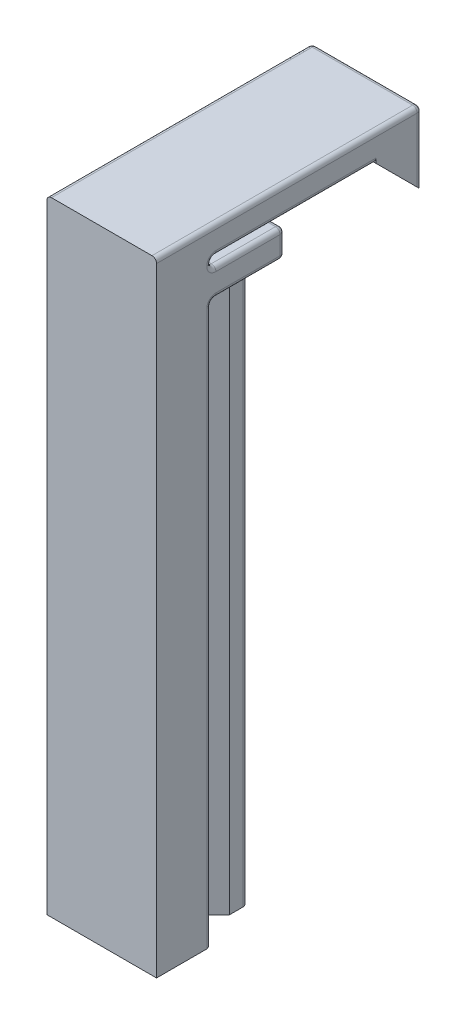
from build123d import *

# Parameters (mm, degrees)
BOSS_EXTRU_1_DEPTH      = 65
ESQUISSE2_W             = 11.96
ESQUISSE2_H             = 28.94
BOSS_EXTRU_2_DEPTH      = 3
ESQUISSE3_W             = 11.96
ESQUISSE3_H             = 8
BOSS_EXTRU_3_DEPTH      = 5
CHANFREIN4_SIZE         = 2
ESQUISSE8_W             = 7.98
ESQUISSE8_H             = 5
ENL_V_MAT_EXTRU_1_DEPTH = 5.96
ESQUISSE9_W             = 3.92
ESQUISSE9_H             = 5
BOSS_EXTRU_5_DEPTH      = 8
BOSS_EXTRU_4_DEPTH      = 8
CONG_2_R                = 0.5
CHANFREIN5_SIZE         = 5


with BuildPart() as part:
    # Esquisse1 → Boss.-Extru.1 (new body)
    with BuildSketch(Plane(origin=(0, 0, 0), x_dir=(1, 0, 0), z_dir=(0, 1, 0))):
        Polygon((7.94, 7.96), (9.97, 7.96), (9.97, 11.94), (1.99, 11.94), (1.99, 7.96), (4.02, 7.96), (4.02, 5.98), (0, 5.98), (0, 0), (11.96, 0), (11.96, 5.98), (7.94, 5.98), align=None)
    extrude(amount=BOSS_EXTRU_1_DEPTH)

    # Esquisse2 → Boss.-Extru.2 (add)
    with BuildSketch(Plane(origin=(0, 65, 0), x_dir=(1, 0, 0), z_dir=(0, 1, 0))):
        with Locations((5.98, 14.47)):
            Rectangle(ESQUISSE2_W, ESQUISSE2_H)
    extrude(amount=BOSS_EXTRU_2_DEPTH)

    # Esquisse3 → Boss.-Extru.3 (add)
    with BuildSketch(Plane(origin=(0, 0, -28.94), x_dir=(-1, 0, 0), z_dir=(0, 0, -1))):
        with Locations((-5.98, 64)):
            Rectangle(ESQUISSE3_W, ESQUISSE3_H)
    extrude(amount=-BOSS_EXTRU_3_DEPTH)

    # Chanfrein4
    chanfrein4_edges = [part.edges().sort_by_distance(p)[0] for p in [
        (1.99, 32.5, -7.96),
        (9.97, 32.5, -7.96),
    ]]
    chamfer(chanfrein4_edges, length=CHANFREIN4_SIZE)

    # Esquisse8 → Enlèv. mat.-Extru.1 (cut)
    with BuildSketch(Plane(origin=(0, 0, -11.94), x_dir=(-1, 0, 0), z_dir=(0, 0, -1))):
        with Locations((-5.98, 62.5)):
            Rectangle(ESQUISSE8_W, ESQUISSE8_H)
    extrude(amount=-ENL_V_MAT_EXTRU_1_DEPTH, mode=Mode.SUBTRACT)

    # Esquisse9 → Boss.-Extru.5 (add)
    with BuildSketch(Plane(origin=(0, 0, -5.98), x_dir=(-1, 0, 0), z_dir=(0, 0, -1))):
        with Locations((-5.98, 62.5)):
            Rectangle(ESQUISSE9_W, ESQUISSE9_H)
    extrude(amount=BOSS_EXTRU_5_DEPTH)

    # Esquisse5 → Boss.-Extru.4 (add)
    with BuildSketch(Plane(origin=(0, 0, -5.98), x_dir=(-1, 0, 0), z_dir=(0, 0, -1))):
        with BuildLine():
            Line((-10.46, 64), (-11.96, 64))
            Line((-11.96, 64), (-11.96, 61))
            Line((-11.96, 61), (-10.46, 61))
            ThreePointArc((-10.46, 61), (-8.96, 62.5), (-10.46, 64))
        make_face()
        with BuildLine():
            Line((-1.5, 61), (0, 61))
            Line((0, 61), (0, 64))
            Line((0, 64), (-1.5, 64))
            ThreePointArc((-1.5, 64), (-3, 62.5), (-1.5, 61))
        make_face()
    extrude(amount=BOSS_EXTRU_4_DEPTH)

    # Congé2
    cong_2_edges = [part.edges().sort_by_distance(p)[0] for p in [
        (2.01, 0, -5.98),
        (2.01, 65, -5.98),
        (4.02, 65, -9.98),
        (7.94, 65, -9.98),
        (4.02, 62.5, -13.98),
        (5.98, 65, -13.98),
        (7.94, 62.5, -13.98),
        (5.98, 60, -13.98),
        (5.98, 0, -11.94),
        (0, 30.5, -5.98),
        (3, 62.5, -5.98),
        (0.75, 61, -5.98),
        (0, 61, -9.98),
        (0.75, 64, -5.98),
        (0, 64, -9.98),
        (3, 62.5, -13.98),
        (0.75, 61, -13.98),
        (0, 62.5, -13.98),
        (0.75, 64, -13.98),
        (11.96, 30.5, -5.98),
        (8.96, 62.5, -5.98),
        (11.21, 64, -5.98),
        (9.95, 0, -5.98),
        (11.96, 64, -9.98),
        (11.21, 61, -5.98),
        (11.96, 61, -9.98),
        (8.96, 62.5, -13.98),
        (11.21, 64, -13.98),
        (11.96, 62.5, -13.98),
        (11.21, 61, -13.98),
        (9.95, 65, -5.98),
        (0, 64.5, -5.98),
        (11.96, 64.5, -5.98),
        (0, 64, -28.94),
        (11.96, 65, -14.96),
        (11.96, 64, -28.94),
        (0, 68, -14.47),
        (11.96, 68, -14.47),
        (5.98, 68, -28.94),
        (0, 65, -14.96),
        (1.99, 30, -11.94),
        (9.97, 30, -11.94),
    ]]
    fillet(cong_2_edges, radius=CONG_2_R - 0.0001)  # a hair under: the kernel refuses the full size

    # Chanfrein5
    chanfrein5_edges = [part.edges().sort_by_distance(p)[0] for p in [
        (5.98, 60, -23.94),
    ]]
    chamfer(chanfrein5_edges, length=CHANFREIN5_SIZE - 0.0001)  # a hair under: the kernel refuses the full size


solid = part.part
